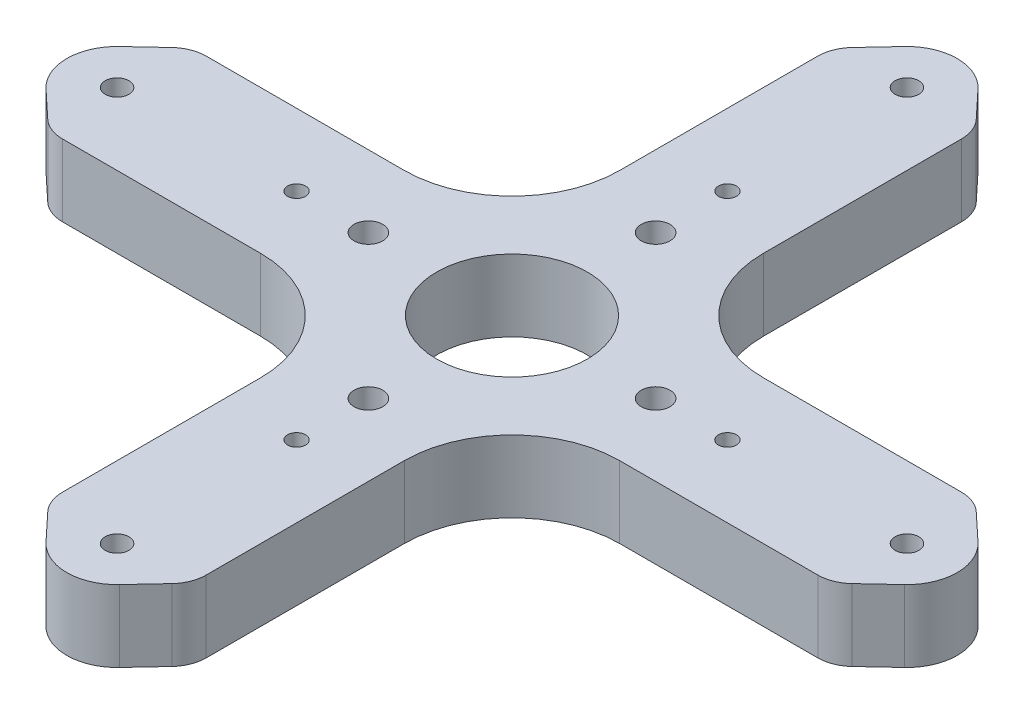
from build123d import *

# Parameters (mm, degrees)
SKETCH1_R             = 2
SKETCH1_R_2           = 10.5
BOSS_EXTRUDE1_DEPTH   = 10
FILLET1_R             = 15
FILLET2_R             = 5
M4X0_7_TAPPED_HOLE1_D = 3.3
M3X0_5_TAPPED_HOLE1_D = 2.5


with BuildPart() as part:
    # Sketch1 → Boss-Extrude1 (new body)
    with BuildSketch(Plane(origin=(0, 0, 0), x_dir=(1, 0, 0), z_dir=(0, 1, 0))):
        with BuildLine():
            Line((10, 10), (54.556312231, 10))
            Line((54.556312231, 10), (59.781818182, 5.112163424))
            ThreePointArc((59.781818182, 5.112163424), (62, 0), (59.781818182, -5.112163424))
            Line((59.781818182, -5.112163424), (54.556312231, -10))
            Line((54.556312231, -10), (10, -10))
            Line((10, -10), (10, -54.556312231))
            Line((10, -54.556312231), (5.112163424, -59.781818182))
            ThreePointArc((5.112163424, -59.781818182), (0, -62), (-5.112163424, -59.781818182))
            Line((-5.112163424, -59.781818182), (-10, -54.556312231))
            Line((-10, -54.556312231), (-10, -10))
            Line((-10, -10), (-54.556312231, -10))
            Line((-54.556312231, -10), (-59.781818182, -5.112163424))
            ThreePointArc((-59.781818182, -5.112163424), (-62, 0), (-59.781818182, 5.112163424))
            Line((-59.781818182, 5.112163424), (-54.556312231, 10))
            Line((-54.556312231, 10), (-10, 10))
            Line((-10, 10), (-10, 54.556312231))
            Line((-10, 54.556312231), (-5.112163424, 59.781818182))
            ThreePointArc((-5.112163424, 59.781818182), (0, 62), (5.112163424, 59.781818182))
            Line((5.112163424, 59.781818182), (10, 54.556312231))
            Line((10, 54.556312231), (10, 10))
        make_face()
        with Locations((-20, 0)):
            Circle(SKETCH1_R, mode=Mode.SUBTRACT)
        with Locations((0, 20)):
            Circle(SKETCH1_R, mode=Mode.SUBTRACT)
        with Locations((20, 0)):
            Circle(SKETCH1_R, mode=Mode.SUBTRACT)
        with Locations((0, -20)):
            Circle(SKETCH1_R, mode=Mode.SUBTRACT)
        Circle(SKETCH1_R_2, mode=Mode.SUBTRACT)
    extrude(amount=BOSS_EXTRUDE1_DEPTH)

    # Fillet1
    fillet1_edges = [part.edges().sort_by_distance(p)[0] for p in [
        (-10, 5, 10),
        (-10, 5, -10),
        (10, 5, -10),
        (10, 5, 10),
    ]]
    fillet(fillet1_edges, radius=FILLET1_R)

    # Fillet2
    fillet2_edges = [part.edges().sort_by_distance(p)[0] for p in [
        (-54.556312231, 5, 10),
        (-54.556312231, 5, -10),
        (-10, 5, -54.556312231),
        (10, 5, -54.556312231),
        (54.556312231, 5, -10),
        (54.556312231, 5, 10),
        (-10, 5, 54.556312231),
        (10, 5, 54.556312231),
    ]]
    fillet(fillet2_edges, radius=FILLET2_R)

    # M4x0.7 Tapped Hole1 (through all)
    with Locations(Plane(origin=(0, 0, 0), x_dir=(-1, 0, 0), z_dir=(0, -1, 0))):
        with Locations((0, -55), (-55, 0), (0, 55), (55, 0)):
            Hole(M4X0_7_TAPPED_HOLE1_D / 2)

    # M3x0.5 Tapped Hole1 (through all)
    with Locations(Plane(origin=(0, 0, 0), x_dir=(-1, 0, 0), z_dir=(0, -1, 0))):
        with Locations((0, -30), (-30, 0), (0, 30), (30, 0), (0, 0)):
            Hole(M3X0_5_TAPPED_HOLE1_D / 2)


solid = part.part
